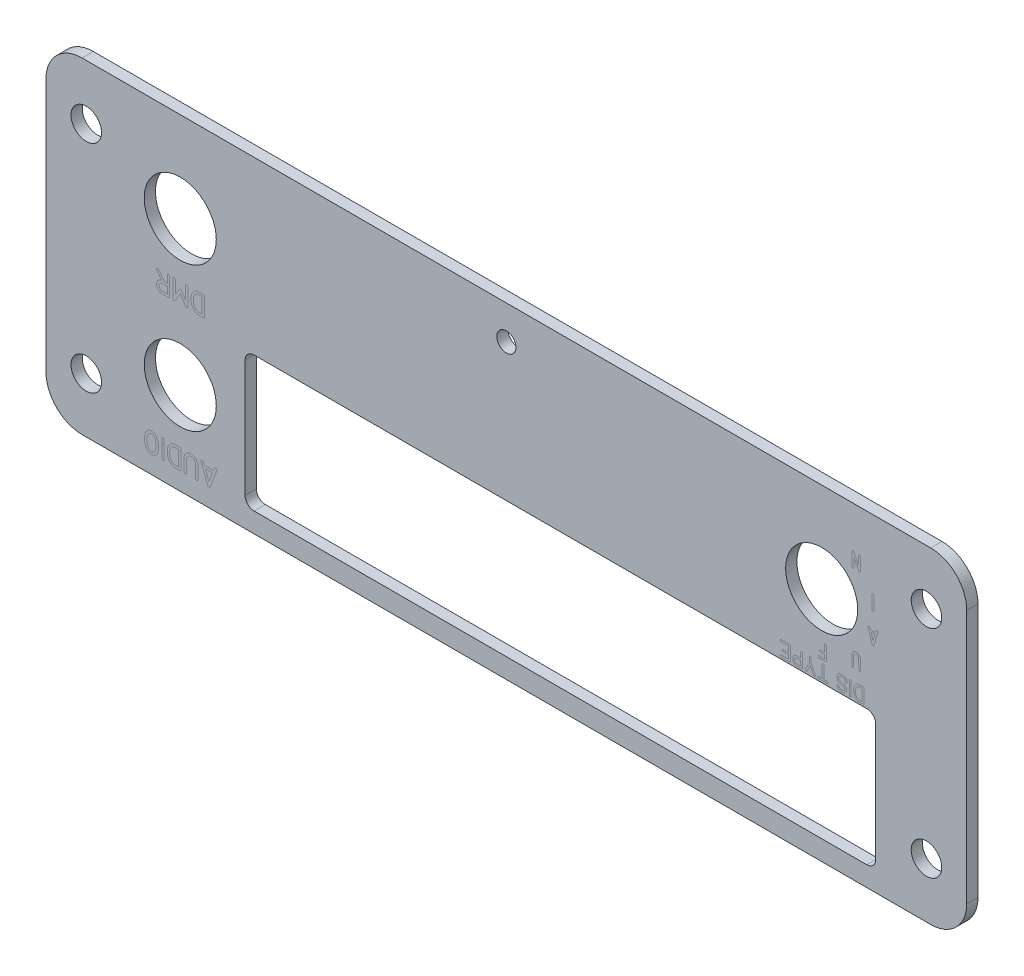
from build123d import *

# Parameters (mm, degrees)
BOSS_EXTRUDE1_DEPTH   = 1.5875
CUT_EXTRUDE1_DEPTH    = 80.547152314
F_6_CLEARANCE_HOLE1_D = 4.3053
SKETCH8_R             = 5.08
CUT_EXTRUDE5_DEPTH    = 80.547152314
SKETCH9_R             = 5.08
CUT_EXTRUDE3_DEPTH    = 80.547152314
F_6_32_TAPPED_HOLE1_D = 2.7051


with BuildPart() as part:
    # Sketch1 → Boss-Extrude1 (new body)
    with BuildSketch(Plane.XY):
        with BuildLine():
            Line((-59.817, -45.974), (59.817, -45.974))
            ThreePointArc((59.817, -45.974), (63.409102448, -44.486102448), (64.897, -40.894))
            Line((64.897, -40.894), (64.897, -5.08))
            ThreePointArc((64.897, -5.08), (63.409102448, -1.487897552), (59.817, 0))
            Line((59.817, 0), (-59.817, 0))
            ThreePointArc((-59.817, 0), (-63.409102448, -1.487897552), (-64.897, -5.08))
            Line((-64.897, -5.08), (-64.897, -40.894))
            ThreePointArc((-64.897, -40.894), (-63.409102448, -44.486102448), (-59.817, -45.974))
        make_face()
    extrude(amount=BOSS_EXTRUDE1_DEPTH)

    # Sketch5 → Cut-Extrude1 (cut, through all)
    with BuildSketch(Plane.XY.offset(1.5875)):
        with BuildLine():
            Line((52.07, -41.91), (52.07, -25.4))
            ThreePointArc((52.07, -25.4), (51.698025612, -24.501974388), (50.8, -24.13))
            Line((50.8, -24.13), (-35.56, -24.13))
            ThreePointArc((-35.56, -24.13), (-36.458025612, -24.501974388), (-36.83, -25.4))
            Line((-36.83, -25.4), (-36.83, -41.91))
            ThreePointArc((-36.83, -41.91), (-36.458025612, -42.808025612), (-35.56, -43.18))
            Line((-35.56, -43.18), (50.8, -43.18))
            ThreePointArc((50.8, -43.18), (51.698025612, -42.808025612), (52.07, -41.91))
        make_face()
    extrude(amount=-CUT_EXTRUDE1_DEPTH, mode=Mode.SUBTRACT)

    # #6 Clearance Hole1 (through all)
    with Locations(Plane.XY.offset(1.5875)):
        with Locations((59.2201, -7.747), (59.2201, -38.227), (-59.2201, -38.227), (-59.2201, -7.747)):
            Hole(F_6_CLEARANCE_HOLE1_D / 2)

    # Sketch8 → Cut-Extrude5 (cut, through all)
    with BuildSketch(Plane.XY.offset(1.5875)):
        with Locations((44.45, -12.7)):
            Circle(SKETCH8_R)
    extrude(amount=-CUT_EXTRUDE5_DEPTH, mode=Mode.SUBTRACT)

    # Sketch9 → Cut-Extrude3 (cut, through all)
    with BuildSketch(Plane.XY.offset(1.5875)):
        with Locations((-45.974, -12.7)):
            Circle(SKETCH9_R)
        with Locations((-45.974, -33.02)):
            Circle(SKETCH9_R)
    extrude(amount=-CUT_EXTRUDE3_DEPTH, mode=Mode.SUBTRACT)

    # #6-32 Tapped Hole1 (through all)
    with Locations(Plane.XY.offset(1.5875)):
        with Locations((0, -4.757510223)):
            Hole(F_6_32_TAPPED_HOLE1_D / 2)


solid = part.part
